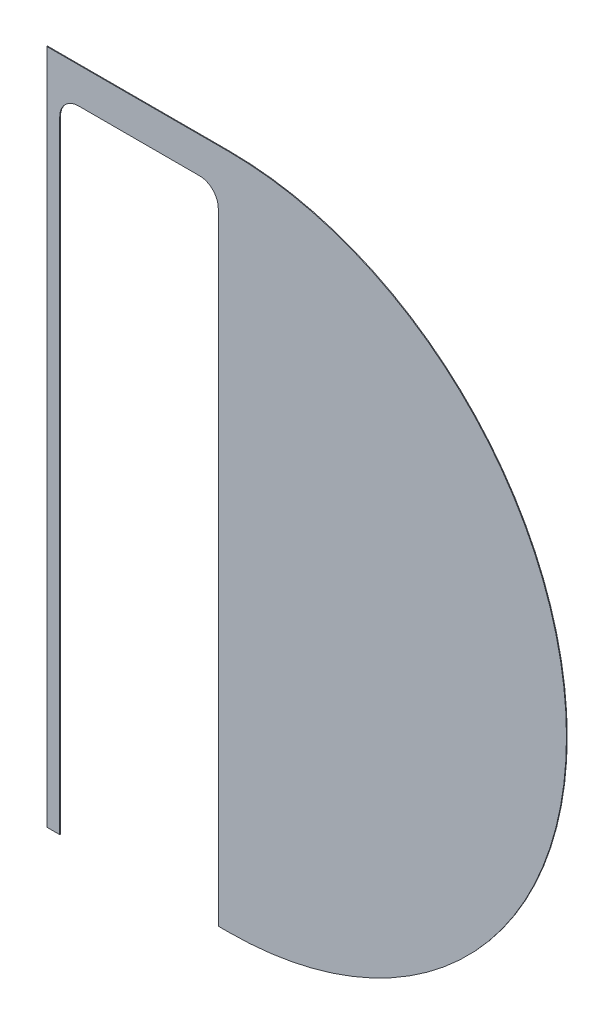
from build123d import *

# Parameters (mm, degrees)
BOSS_EXTRUDE1_DEPTH = 2
CUT_EXTRUDE1_DEPTH  = 2276.151547165


with BuildPart() as part:
    # Sketch1 → Boss-Extrude1 (new body)
    with BuildSketch(Plane.XY):
        with BuildLine():
            Line((0, 0), (485, 0))
            ThreePointArc((485, 0), (1387.5, 902.5), (485, 1805))
            Line((485, 1805), (0, 1805))
            Line((0, 1805), (0, 0))
        make_face()
    extrude(amount=BOSS_EXTRUDE1_DEPTH)

    # Sketch2 → Cut-Extrude1 (cut, through all)
    with BuildSketch(Plane(origin=(-134.893544062, 114.252100529, 0), x_dir=(-1, 0, 0), z_dir=(0, 0, -1))):
        with BuildLine():
            Line((-592.773575067, -114.252100529), (-169.572129607, -114.252100529))
            Line((-169.572129607, -114.252100529), (-169.572129607, 1545.594593054))
            ThreePointArc((-169.572129607, 1545.594593054), (-184.216790548, 1580.949932113), (-219.572129607, 1595.594593054))
            Line((-219.572129607, 1595.594593054), (-542.773575067, 1595.594593054))
            ThreePointArc((-542.773575067, 1595.594593054), (-578.128914126, 1580.949932113), (-592.773575067, 1545.594593054))
            Line((-592.773575067, 1545.594593054), (-592.773575067, -114.252100529))
        make_face()
    extrude(amount=-CUT_EXTRUDE1_DEPTH, mode=Mode.SUBTRACT)


solid = part.part
